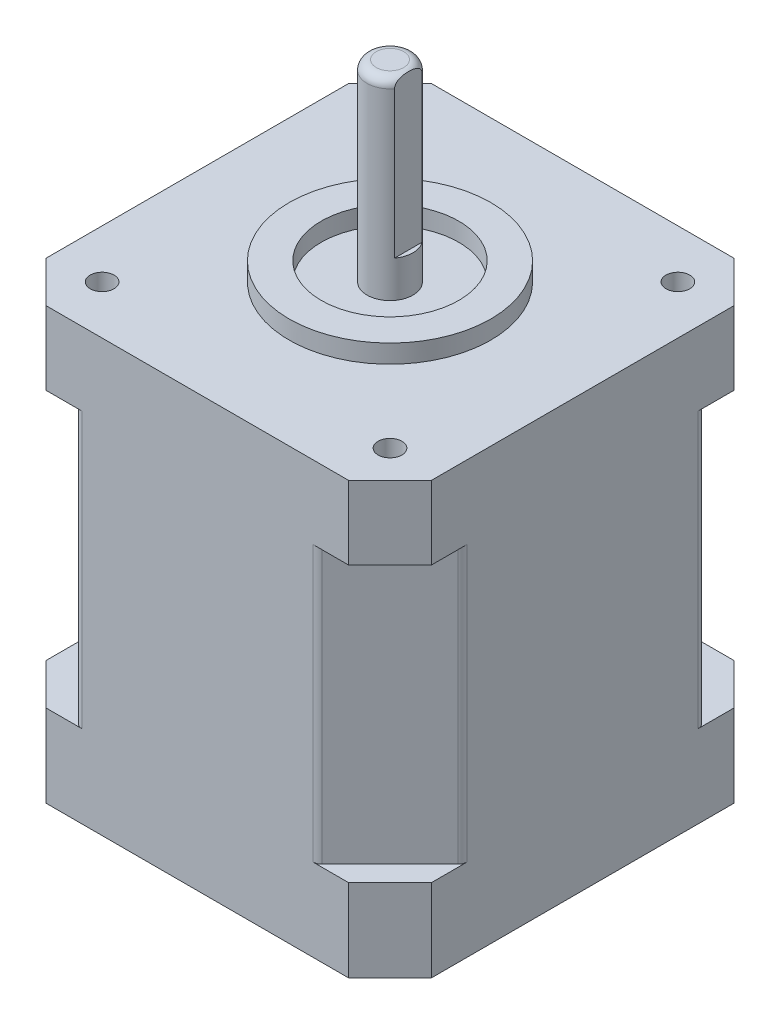
from build123d import *

# Parameters (mm, degrees)
SALIENTE_EXTRUIR1_DEPTH = 9
SALIENTE_EXTRUIR2_START = 9
SALIENTE_EXTRUIR2_DEPTH = 30
REDONDEO3_R             = 1
SALIENTE_EXTRUIR3_START = 39
SALIENTE_EXTRUIR3_DEPTH = 8
CORTAR_EXTRUIR1_START   = 47
CROQUIS4_R              = 1.3
CORTAR_EXTRUIR1_DEPTH   = 5
SALIENTE_EXTRUIR4_START = 47
CROQUIS5_R              = 11
CROQUIS5_R_2            = 7.5
SALIENTE_EXTRUIR4_DEPTH = 2
SALIENTE_EXTRUIR5_START = 47
CROQUIS6_R              = 2.5
SALIENTE_EXTRUIR5_DEPTH = 21
CORTAR_EXTRUIR2_START   = 51
CORTAR_EXTRUIR2_DEPTH   = 17
REDONDEO4_R             = 1


with BuildPart() as part:
    # Croquis1 → Saliente-Extruir1 (new body)
    with BuildSketch(Plane(origin=(0, 0, 0), x_dir=(1, 0, 0), z_dir=(0, 1, 0))):
        Polygon((-16.5, 21), (-21, 16.5), (-21, -16.5), (-16.5, -21), (16.5, -21), (21, -16.5), (21, 16.5), (16.5, 21), (8.5, 21), (8.5, 25), (-8.5, 25), (-8.5, 21), align=None)
    extrude(amount=SALIENTE_EXTRUIR1_DEPTH)

    # Croquis2 → Saliente-Extruir2 (add)
    with BuildSketch(Plane(origin=(0, 0, 0), x_dir=(1, 0, 0), z_dir=(0, 1, 0)).offset(SALIENTE_EXTRUIR2_START)):
        Polygon((13, 21), (21, 13), (21, -13), (13, -21), (-13, -21), (-21, -13), (-21, 13), (-13, 21), align=None)
    extrude(amount=SALIENTE_EXTRUIR2_DEPTH)

    # Redondeo3
    redondeo3_edges = [part.edges().sort_by_distance(p)[0] for p in [
        (13, 24, -21),
        (-13, 24, -21),
        (-21, 24, -13),
        (-21, 24, 13),
        (-13, 24, 21),
        (13, 24, 21),
        (21, 24, 13),
        (21, 24, -13),
    ]]
    fillet(redondeo3_edges, radius=REDONDEO3_R)

    # Croquis3 → Saliente-Extruir3 (add)
    with BuildSketch(Plane(origin=(0, 0, 0), x_dir=(1, 0, 0), z_dir=(0, 1, 0)).offset(SALIENTE_EXTRUIR3_START)):
        Polygon((-16.5, 21), (-21, 16.5), (-21, -16.5), (-16.5, -21), (16.5, -21), (21, -16.5), (21, 16.5), (16.5, 21), align=None)
    extrude(amount=SALIENTE_EXTRUIR3_DEPTH)

    # Croquis4 → Cortar-Extruir1 (cut)
    with BuildSketch(Plane(origin=(0, 0, 0), x_dir=(1, 0, 0), z_dir=(0, 1, 0)).offset(CORTAR_EXTRUIR1_START)):
        with Locations(Location((-15.7, 15.7, 0), (0, 0, 270))):
            Circle(CROQUIS4_R)
        with Locations(Location((15.7, 15.7, 0), (0, 0, 270))):
            Circle(CROQUIS4_R)
        with Locations(Location((15.7, -15.7, 0), (0, 0, 270))):
            Circle(CROQUIS4_R)
        with Locations(Location((-15.7, -15.7, 0), (0, 0, 270))):
            Circle(CROQUIS4_R)
    extrude(amount=-CORTAR_EXTRUIR1_DEPTH, mode=Mode.SUBTRACT)

    # Croquis5 → Saliente-Extruir4 (add)
    with BuildSketch(Plane(origin=(0, 0, 0), x_dir=(1, 0, 0), z_dir=(0, 1, 0)).offset(SALIENTE_EXTRUIR4_START)):
        with Locations(Location((0, 0, 0), (0, 0, 90))):
            Circle(CROQUIS5_R)
        with Locations(Location((0, 0, 0), (0, 0, 270))):
            Circle(CROQUIS5_R_2, mode=Mode.SUBTRACT)
    extrude(amount=SALIENTE_EXTRUIR4_DEPTH)

    # Croquis6 → Saliente-Extruir5 (add)
    with BuildSketch(Plane(origin=(0, 0, 0), x_dir=(1, 0, 0), z_dir=(0, 1, 0)).offset(SALIENTE_EXTRUIR5_START)):
        with Locations(Location((0, 0, 0), (0, 0, 90))):
            Circle(CROQUIS6_R)
    extrude(amount=SALIENTE_EXTRUIR5_DEPTH)

    # Croquis7 → Cortar-Extruir2 (cut)
    with BuildSketch(Plane(origin=(0, 0, 0), x_dir=(1, 0, 0), z_dir=(0, 1, 0)).offset(CORTAR_EXTRUIR2_START)):
        with BuildLine():
            Line((2, -1.5), (2, 1.5))
            ThreePointArc((2, 1.5), (2.5, 0), (2, -1.5))
        make_face()
    extrude(amount=CORTAR_EXTRUIR2_DEPTH, mode=Mode.SUBTRACT)

    # Redondeo4
    # the kernel refuses this fillet: 1 mm, written as the material it takes off along each edge
    with BuildSketch(Plane(origin=(0, 68, 0), x_dir=(0, 0, -1), z_dir=(1, 0, 0))) as redondeo4_piece_1:
        with BuildLine():
            CenterArc((2.5 - REDONDEO4_R, -REDONDEO4_R), REDONDEO4_R, 0, 90)
            Line((2.5 - REDONDEO4_R, 0), (2.5, 0))
            Line((2.5, 0), (2.5, -REDONDEO4_R))
        make_face()
    revolve(axis=Axis((0, 68, 0), (0, 1, 0)), revolution_arc=290.580564901, mode=Mode.SUBTRACT)
    with BuildSketch(Plane(origin=(0, 68, 0), x_dir=(0.9370755783657725, 0, 0.34912656792408847), z_dir=(-0.34912656792408847, 0, 0.9370755783657725))) as redondeo4_piece_2:
        with BuildLine():
            CenterArc((2.5 - REDONDEO4_R, -REDONDEO4_R), REDONDEO4_R, 0, 90)
            Line((2.5 - REDONDEO4_R, 0), (2.5, 0))
            Line((2.5, 0), (2.5, -REDONDEO4_R))
        make_face()
    revolve(axis=Axis((0, 68, 0), (0, 1, 0)), revolution_arc=110.433901418, mode=Mode.SUBTRACT)


solid = part.part
